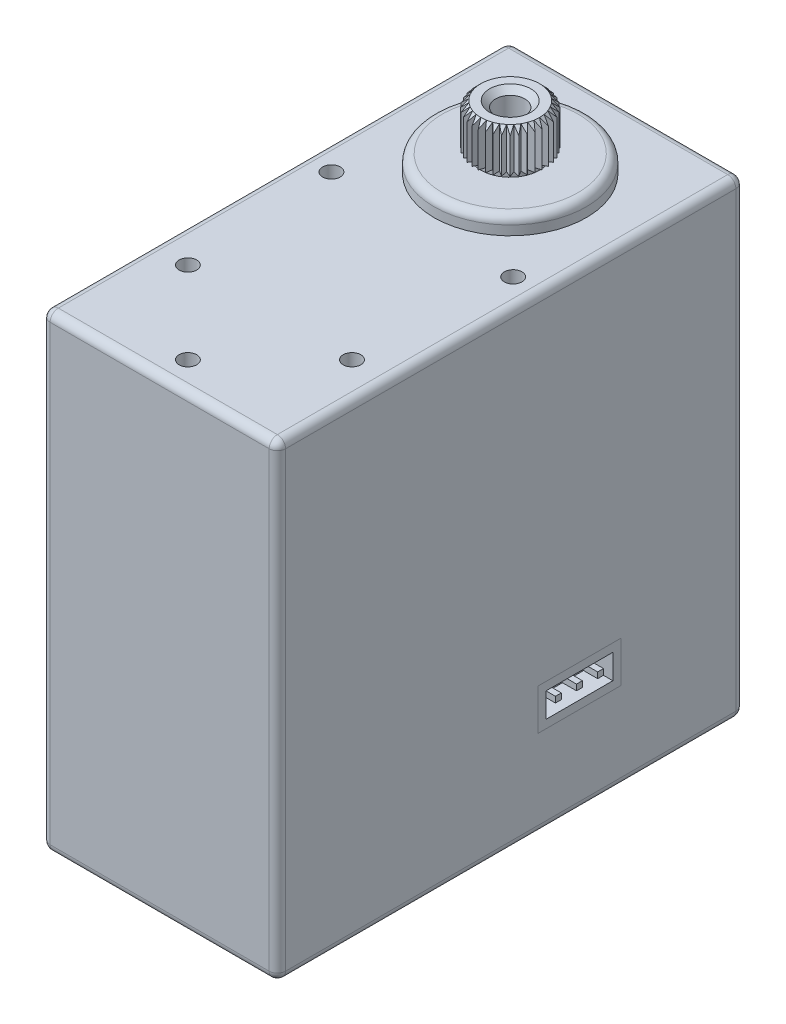
from build123d import *

# Parameters (mm, degrees)
CROQUIS2_R                 = 3
SALIENTE_EXTRUIR1_DEPTH    = 5.4
CROQUIS2_4_R               = 6.5
SALIENTE_EXTRUIR2_DEPTH    = 1.5
CROQUIS2_6_W               = 20.09
CROQUIS2_6_H               = 39.82
SALIENTE_EXTRUIR3_DEPTH    = 40
CROQUIS2_7_R               = 0.75
CORTAR_EXTRUIR1_DEPTH      = 2
SALIENTE_EXTRUIR4_START    = -41.5
CROQUIS2_8_R               = 6.5
SALIENTE_EXTRUIR4_DEPTH    = 41.5
SALIENTE_EXTRUIR5_START    = -45.7
CROQUIS2_10_R              = 3
SALIENTE_EXTRUIR5_DEPTH    = 45.7
CROQUIS3_R                 = 0.75
CORTAR_EXTRUIR2_DEPTH      = 2
CROQUIS5_W                 = 7.09
CROQUIS5_H                 = 3.5
CROQUIS5_W_2               = 5.69
CROQUIS5_H_2               = 2.1
CORTAR_EXTRUIR5_DEPTH      = 2
CROQUIS5_4_W               = 7.09
CROQUIS5_4_H               = 3.5
CROQUIS5_4_W_2             = 5.69
CROQUIS5_4_H_2             = 2.1
SALIENTE_EXTRUIR6_DEPTH    = 2
CROQUIS8_W                 = 7.09
CROQUIS8_H                 = 3.5
CROQUIS8_W_2               = 5.69
CROQUIS8_H_2               = 2.1
CORTAR_EXTRUIR6_DEPTH      = 2
CROQUIS8_6_W               = 7.09
CROQUIS8_6_H               = 3.5
CROQUIS8_6_W_2             = 5.69
CROQUIS8_6_H_2             = 2.1
SALIENTE_EXTRUIR9_DEPTH    = 2
REDONDEO1_R                = 0.7
REDONDEO2_R                = 0.7
CHAFL_N1_SIZE              = 0.5
CROQUIS9_R                 = 5.8
CORTAR_EXTRUIR13_DEPTH     = 3.5
CORTAR_EXTRUIR15_START     = -0.4
CROQUIS10_R                = 3
CROQUIS10_R_2              = 2.5
CORTAR_EXTRUIR15_DEPTH     = 0.4
CROQUIS11_R                = 1.25
CORTAR_EXTRUIR16_DEPTH     = 4
CHAFL_N2_SIZE              = 0.5
CROQUIS12_W                = 0.5
CROQUIS12_H                = 0.5
SALIENTE_EXTRUIR13_DEPTH   = 2
SALIENTE_EXTRUIR13_2_DEPTH = 2
SALIENTE_EXTRUIR13_3_DEPTH = 2
CROQUIS13_W                = 0.5
CROQUIS13_H                = 0.5
SALIENTE_EXTRUIR14_DEPTH   = 2
SALIENTE_EXTRUIR14_2_DEPTH = 2
SALIENTE_EXTRUIR14_3_DEPTH = 2


with BuildPart() as part:
    # Croquis2 → Saliente-Extruir1 (new body)
    with BuildSketch(Plane(origin=(0, 0, 0), x_dir=(1, 0, 0), z_dir=(0, 1, 0))):
        with Locations(Location((0, 0, 0), (0, 0, 90))):
            Circle(CROQUIS2_R)
    extrude(amount=SALIENTE_EXTRUIR1_DEPTH)

    # Croquis2<4> → Saliente-Extruir2 (add)
    with BuildSketch(Plane(origin=(0, 0, 0), x_dir=(1, 0, 0), z_dir=(0, 1, 0))):
        with Locations(Location((0, 0, 0), (0, 0, 270))):
            Circle(CROQUIS2_4_R)
    extrude(amount=SALIENTE_EXTRUIR2_DEPTH)



with BuildPart() as body_2:
    # Croquis2<6> → Saliente-Extruir3 (new body)
    with BuildSketch(Plane(origin=(0, 0, 0), x_dir=(1, 0, 0), z_dir=(0, 1, 0))):
        with Locations((0, -10)):
            Rectangle(CROQUIS2_6_W, CROQUIS2_6_H)
    extrude(amount=-SALIENTE_EXTRUIR3_DEPTH)

    # Croquis2<7> → Cortar-Extruir1 (cut)
    with BuildSketch(Plane(origin=(0, 0, 0), x_dir=(1, 0, 0), z_dir=(0, 1, 0))):
        with Locations(Location((0, -27.5, 0), (0, 0, 270))):
            Circle(CROQUIS2_7_R)
        with Locations(Location((7, -20.5, 0), (0, 0, 270))):
            Circle(CROQUIS2_7_R)
        with Locations(Location((-7, -20.5, 0), (0, 0, 270))):
            Circle(CROQUIS2_7_R)
        with Locations(Location((-7.75, -7.5, 0), (0, 0, 270))):
            Circle(CROQUIS2_7_R)
        with Locations(Location((7.75, -7.5, 0), (0, 0, 270))):
            Circle(CROQUIS2_7_R)
    extrude(amount=-CORTAR_EXTRUIR1_DEPTH, mode=Mode.SUBTRACT)


with BuildPart() as part_1:
    add(part.part)

    add(body_2.part)  # Saliente-Extruir4 merges body 2
    # Croquis2<8> → Saliente-Extruir4 (add)
    with BuildSketch(Plane(origin=(0, 0, 0), x_dir=(1, 0, 0), z_dir=(0, 1, 0)).offset(SALIENTE_EXTRUIR4_START)):
        with Locations(Location((0, 0, 0), (0, 0, 270))):
            Circle(CROQUIS2_8_R)
    extrude(amount=SALIENTE_EXTRUIR4_DEPTH)

    # Croquis2<10> → Saliente-Extruir5 (add)
    with BuildSketch(Plane(origin=(0, 0, 0), x_dir=(1, 0, 0), z_dir=(0, 1, 0)).offset(SALIENTE_EXTRUIR5_START)):
        with Locations(Location((0, 0, 0), (0, 0, 90))):
            Circle(CROQUIS2_10_R)
    extrude(amount=SALIENTE_EXTRUIR5_DEPTH)

    # Croquis3 → Cortar-Extruir2 (cut)
    with BuildSketch(Plane.XZ.offset(40)):
        with Locations(Location((-7.5, 12.5, 0), (0, 0, 270))):
            Circle(CROQUIS3_R)
        with Locations(Location((-7.5, -7.5, 0), (0, 0, 270))):
            Circle(CROQUIS3_R)
        with Locations(Location((-7.5, 27.5, 0), (0, 0, 270))):
            Circle(CROQUIS3_R)
        with Locations(Location((7.5, -7.5, 0), (0, 0, 90))):
            Circle(CROQUIS3_R)
        with Locations(Location((7.5, 12.5, 0), (0, 0, 90))):
            Circle(CROQUIS3_R)
        with Locations(Location((7.5, 27.5, 0), (0, 0, 90))):
            Circle(CROQUIS3_R)
    extrude(amount=-CORTAR_EXTRUIR2_DEPTH, mode=Mode.SUBTRACT)

    # Croquis5 → Cortar-Extruir5 (cut)
    # profile 1 of 2: a face of its own
    with BuildSketch(Plane(origin=(0, 0, -9.91), x_dir=(-1, 0, 0), z_dir=(0, 0, -1))):
        with Locations((0, -30.75)):
            Rectangle(CROQUIS5_W, CROQUIS5_H)
        with Locations((0, -30.75)):
            Rectangle(CROQUIS5_W_2, CROQUIS5_H_2, mode=Mode.SUBTRACT)
    # profile 2 of 2: a face of its own
    with BuildSketch(Plane(origin=(0, 0, -9.91), x_dir=(-1, 0, 0), z_dir=(0, 0, -1))):
        with Locations((0, -30.75)):
            Rectangle(CROQUIS5_W_2, CROQUIS5_H_2)
    extrude(amount=-CORTAR_EXTRUIR5_DEPTH, mode=Mode.SUBTRACT)

    # Croquis8 → Cortar-Extruir6 (cut)
    # profile 1 of 2: a face of its own
    with BuildSketch(Plane.ZY.offset(10.045)):
        with Locations((4.135, -30.75)):
            Rectangle(CROQUIS8_W, CROQUIS8_H)
        with Locations((4.135, -30.75)):
            Rectangle(CROQUIS8_W_2, CROQUIS8_H_2, mode=Mode.SUBTRACT)
    # profile 2 of 2: a face of its own
    with BuildSketch(Plane.ZY.offset(10.045)):
        with Locations((4.135, -30.75)):
            Rectangle(CROQUIS8_W_2, CROQUIS8_H_2)
    cortar_extruir6 = extrude(amount=-CORTAR_EXTRUIR6_DEPTH, mode=Mode.SUBTRACT)

    # Simetría1: Cortar-Extruir6 across plane
    add(cortar_extruir6.mirror(Plane(origin=(0, 0, 0), x_dir=(0, 0, 1), z_dir=(1, 0, 0))), mode=Mode.SUBTRACT)

    # Redondeo1
    redondeo1_edges = [part_1.edges().sort_by_distance(p)[0] for p in [
        (0, 0, 29.91),
        (10.045, 0, 10),
        (-10.045, 0, 10),
        (-10.045, -20, 29.91),
        (0, 0, -9.91),
        (-10.045, -20, -9.91),
        (10.045, -40, 10),
        (10.045, -20, -9.91),
        (0, -40, 29.91),
        (10.045, -20, 29.91),
        (-10.045, -40, 10),
        (0, -40, -9.91),
    ]]
    fillet(redondeo1_edges, radius=REDONDEO1_R)

    # Redondeo2
    redondeo2_edges = [part_1.edges().sort_by_distance(p)[0] for p in [
        (0, -41.5, -6.5),
        (0, -41.5, 3),
        (0, 1.5, -6.5),
    ]]
    fillet(redondeo2_edges, radius=REDONDEO2_R)

    # Chaflán1
    chafl_n1_edges = [part_1.edges().sort_by_distance(p)[0] for p in [
        (0, 5.4, 3),
    ]]
    chamfer(chafl_n1_edges, length=CHAFL_N1_SIZE)

    # Croquis9 → Cortar-Extruir13 (cut)
    with BuildSketch(Plane(origin=(0, 5.4, 0), x_dir=(1, 0, 0), z_dir=(0, 1, 0))):
        Circle(CROQUIS9_R)
        Polygon((0, 2.5), (0.261467228, 2.988584094), (0.434120444, 2.462019383), (0.776457135, 2.897777479), (0.855050358, 2.349231552), (1.267854785, 2.718923361), (1.25, 2.165063509), (1.720729309, 2.457456133), (1.606969024, 1.915111108), (2.121320344, 2.121320344), (1.915111108, 1.606969024), (2.457456133, 1.720729309), (2.165063509, 1.25), (2.718923361, 1.267854785), (2.349231552, 0.855050358), (2.897777479, 0.776457135), (2.462019383, 0.434120444), (2.988584094, 0.261467228), (2.5, 0), (2.988584094, -0.261467228), (2.462019383, -0.434120444), (2.897777479, -0.776457135), (2.349231552, -0.855050358), (2.718923361, -1.267854785), (2.165063509, -1.25), (2.457456133, -1.720729309), (1.915111108, -1.606969024), (2.121320344, -2.121320344), (1.606969024, -1.915111108), (1.720729309, -2.457456133), (1.25, -2.165063509), (1.267854785, -2.718923361), (0.855050358, -2.349231552), (0.776457135, -2.897777479), (0.434120444, -2.462019383), (0.261467228, -2.988584094), (0, -2.5), (-0.261467228, -2.988584094), (-0.434120444, -2.462019383), (-0.776457135, -2.897777479), (-0.855050358, -2.349231552), (-1.267854785, -2.718923361), (-1.25, -2.165063509), (-1.720729309, -2.457456133), (-1.606969024, -1.915111108), (-2.121320344, -2.121320344), (-1.915111108, -1.606969024), (-2.457456133, -1.720729309), (-2.165063509, -1.25), (-2.718923361, -1.267854785), (-2.349231552, -0.855050358), (-2.897777479, -0.776457135), (-2.462019383, -0.434120444), (-2.988584094, -0.261467228), (-2.5, 0), (-2.988584094, 0.261467228), (-2.462019383, 0.434120444), (-2.897777479, 0.776457135), (-2.349231552, 0.855050358), (-2.718923361, 1.267854785), (-2.165063509, 1.25), (-2.457456133, 1.720729309), (-1.915111108, 1.606969024), (-2.121320344, 2.121320344), (-1.606969024, 1.915111108), (-1.720729309, 2.457456133), (-1.25, 2.165063509), (-1.267854785, 2.718923361), (-0.855050358, 2.349231552), (-0.776457135, 2.897777479), (-0.434120444, 2.462019383), (-0.261467228, 2.988584094), align=None, mode=Mode.SUBTRACT)
    extrude(amount=-CORTAR_EXTRUIR13_DEPTH, mode=Mode.SUBTRACT)

    # Croquis10 → Cortar-Extruir15 (cut)
    with BuildSketch(Plane(origin=(0, 1.9, 0), x_dir=(1, 0, 0), z_dir=(0, 1, 0)).offset(CORTAR_EXTRUIR15_START)):
        with Locations(Location((0, 0, 0), (0, 0, 270))):
            Circle(CROQUIS10_R)
        with Locations(Location((0, 0, 0), (0, 0, 270))):
            Circle(CROQUIS10_R_2, mode=Mode.SUBTRACT)
    extrude(amount=CORTAR_EXTRUIR15_DEPTH, mode=Mode.SUBTRACT)

    # Croquis11 → Cortar-Extruir16 (cut)
    with BuildSketch(Plane(origin=(0, 5.4, 0), x_dir=(1, 0, 0), z_dir=(0, 1, 0))):
        with Locations(Location((0, 0, 0), (0, 0, 270))):
            Circle(CROQUIS11_R)
    extrude(amount=-CORTAR_EXTRUIR16_DEPTH, mode=Mode.SUBTRACT)

    # Chaflán2
    chafl_n2_edges = [part_1.edges().sort_by_distance(p)[0] for p in [
        (0, 5.4, -1.25),
    ]]
    chamfer(chafl_n2_edges, length=CHAFL_N2_SIZE)


with BuildPart() as body_2_2:
    # Croquis5<4> → Saliente-Extruir6 (new body)
    with BuildSketch(Plane(origin=(0, 0, -9.91), x_dir=(-1, 0, 0), z_dir=(0, 0, -1))):
        with Locations((0, -30.75)):
            Rectangle(CROQUIS5_4_W, CROQUIS5_4_H)
        with Locations((0, -30.75)):
            Rectangle(CROQUIS5_4_W_2, CROQUIS5_4_H_2, mode=Mode.SUBTRACT)
    extrude(amount=-SALIENTE_EXTRUIR6_DEPTH)


with BuildPart() as body_3:
    # Croquis8<6> → Saliente-Extruir9 (new body)
    with BuildSketch(Plane.ZY.offset(10.045)):
        with Locations((4.135, -30.75)):
            Rectangle(CROQUIS8_6_W, CROQUIS8_6_H)
        with Locations((4.135, -30.75)):
            Rectangle(CROQUIS8_6_W_2, CROQUIS8_6_H_2, mode=Mode.SUBTRACT)
    extrude(amount=-SALIENTE_EXTRUIR9_DEPTH)


with BuildPart() as body_4:
    # Simetría4: mirrored copy
    add(body_3.part.mirror(Plane(origin=(0, 0, 0), x_dir=(0, 0, 1), z_dir=(1, 0, 0))))


with BuildPart() as body_5:
    # Croquis12 → Saliente-Extruir13 (new body)
    with BuildSketch(Plane(origin=(8.045, 0, 0), x_dir=(0, 0, -1), z_dir=(1, 0, 0))):
        with Locations((-2.335, -30.75)):
            Rectangle(CROQUIS12_W, CROQUIS12_H)
    saliente_extruir13 = extrude(amount=SALIENTE_EXTRUIR13_DEPTH)


with BuildPart() as body_6:
    # Croquis12 → Saliente-Extruir13 2 (new body)
    with BuildSketch(Plane(origin=(8.045, 0, 0), x_dir=(0, 0, -1), z_dir=(1, 0, 0))):
        with Locations((-4.135, -30.75)):
            Rectangle(CROQUIS12_W, CROQUIS12_H)
    saliente_extruir13_2 = extrude(amount=SALIENTE_EXTRUIR13_2_DEPTH)


with BuildPart() as body_7:
    # Croquis12 → Saliente-Extruir13 3 (new body)
    with BuildSketch(Plane(origin=(8.045, 0, 0), x_dir=(0, 0, -1), z_dir=(1, 0, 0))):
        with Locations((-5.935, -30.75)):
            Rectangle(CROQUIS12_W, CROQUIS12_H)
    saliente_extruir13_3 = extrude(amount=SALIENTE_EXTRUIR13_3_DEPTH)


with BuildPart() as part_2:
    add(part_1.part)

    # Simetría5: Saliente-Extruir13, Saliente-Extruir13 2, Saliente-Extruir13 3 across plane
    add(saliente_extruir13.mirror(Plane(origin=(0, 0, 0), x_dir=(0, 0, 1), z_dir=(1, 0, 0))))
    add(saliente_extruir13_2.mirror(Plane(origin=(0, 0, 0), x_dir=(0, 0, 1), z_dir=(1, 0, 0))))
    add(saliente_extruir13_3.mirror(Plane(origin=(0, 0, 0), x_dir=(0, 0, 1), z_dir=(1, 0, 0))))


with BuildPart() as body_8:
    # Croquis13 → Saliente-Extruir14 (new body)
    with BuildSketch(Plane(origin=(0, 0, -7.91), x_dir=(-1, 0, 0), z_dir=(0, 0, -1))):
        with Locations((-1.8, -30.75)):
            Rectangle(CROQUIS13_W, CROQUIS13_H)
    extrude(amount=SALIENTE_EXTRUIR14_DEPTH)


with BuildPart() as body_9:
    # Croquis13 → Saliente-Extruir14 2 (new body)
    with BuildSketch(Plane(origin=(0, 0, -7.91), x_dir=(-1, 0, 0), z_dir=(0, 0, -1))):
        with Locations((0, -30.75)):
            Rectangle(CROQUIS13_W, CROQUIS13_H)
    extrude(amount=SALIENTE_EXTRUIR14_2_DEPTH)


with BuildPart() as body_10:
    # Croquis13 → Saliente-Extruir14 3 (new body)
    with BuildSketch(Plane(origin=(0, 0, -7.91), x_dir=(-1, 0, 0), z_dir=(0, 0, -1))):
        with Locations((1.8, -30.75)):
            Rectangle(CROQUIS13_W, CROQUIS13_H)
    extrude(amount=SALIENTE_EXTRUIR14_3_DEPTH)


solid = Compound([body_2_2.part, body_3.part, body_4.part, body_5.part, body_6.part, body_7.part, part_2.part, body_8.part, body_9.part, body_10.part])
